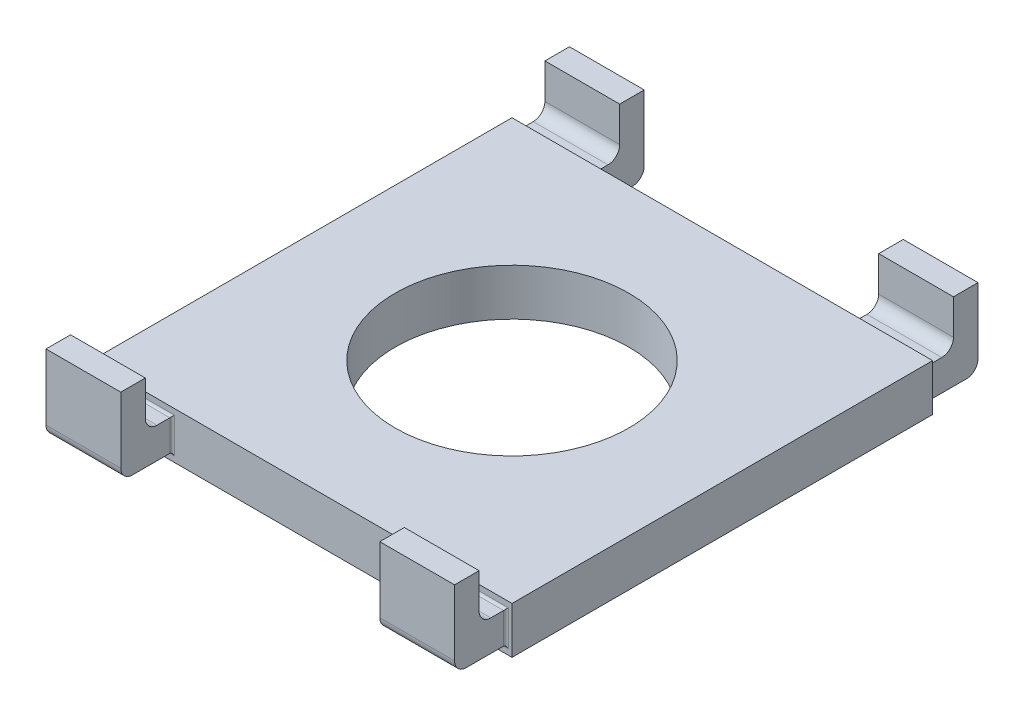
from build123d import *

# Parameters (mm, degrees)
SKETCH2_W           = 45
SKETCH2_H           = 45
BOSS_EXTRUDE1_DEPTH = 5
SKETCH3_W           = 8
SKETCH3_H           = 3.3
BOSS_EXTRUDE2_DEPTH = 28
FILLET1_R           = 0.25
SKETCH4_W           = 8
SKETCH4_H           = 2.625
BOSS_EXTRUDE3_DEPTH = 5
FILLET2_R           = 1.25
SKETCH6_R           = 12.5
CUT_EXTRUDE1_DEPTH  = 19


with BuildPart() as part:
    # Sketch2 → Boss-Extrude1 (new body)
    with BuildSketch(Plane(origin=(0, 0, 0), x_dir=(1, 0, 0), z_dir=(0, 1, 0))):
        Rectangle(SKETCH2_W, SKETCH2_H)
    extrude(amount=BOSS_EXTRUDE1_DEPTH)

    # Sketch3 → Boss-Extrude2 (add, symmetric)
    with BuildSketch(Plane.XY):
        with Locations((-17.853613933, 2.5)):
            Rectangle(SKETCH3_W, SKETCH3_H)
        with Locations((17.853613933, 2.5)):
            Rectangle(SKETCH3_W, SKETCH3_H)
    extrude(amount=BOSS_EXTRUDE2_DEPTH, both=True)

    # Fillet1
    fillet1_edges = [part.edges().sort_by_distance(p)[0] for p in [
        (-13.853613933, 2.5, -22.5),
        (-17.853613933, 4.15, -22.5),
        (-21.853613933, 2.5, -22.5),
        (-17.853613933, 0.85, -22.5),
        (17.853613933, 0.85, -22.5),
        (13.853613933, 2.5, -22.5),
        (21.853613933, 2.5, -22.5),
        (17.853613933, 4.15, -22.5),
        (21.853613933, 2.5, 22.5),
        (17.853613933, 4.15, 22.5),
        (17.853613933, 0.85, 22.5),
        (13.853613933, 2.5, 22.5),
        (-21.853613933, 2.5, 22.5),
        (-13.853613933, 2.5, 22.5),
        (-17.853613933, 0.85, 22.5),
        (-17.853613933, 4.15, 22.5),
    ]]
    fillet(fillet1_edges, radius=FILLET1_R)

    # Sketch4 → Boss-Extrude3 (add)
    with BuildSketch(Plane(origin=(0, 4.15, 0), x_dir=(1, 0, 0), z_dir=(0, 1, 0))):
        with Locations((-17.853613933, 26.6875)):
            Rectangle(SKETCH4_W, SKETCH4_H)
        with Locations((17.853613933, 26.6875)):
            Rectangle(SKETCH4_W, SKETCH4_H)
        with Locations((17.853613933, -26.6875)):
            Rectangle(SKETCH4_W, SKETCH4_H)
        with Locations((-17.853613933, -26.6875)):
            Rectangle(SKETCH4_W, SKETCH4_H)
    extrude(amount=BOSS_EXTRUDE3_DEPTH)

    # Fillet2
    fillet2_edges = [part.edges().sort_by_distance(p)[0] for p in [
        (-17.853613933, 0.85, 28),
        (17.853613933, 0.85, 28),
        (17.853613933, 0.85, -28),
        (-17.853613933, 0.85, -28),
        (17.853613933, 4.15, 25.375),
        (-17.853613933, 4.15, 25.375),
        (17.853613933, 4.15, -25.375),
        (-17.853613933, 4.15, -25.375),
    ]]
    fillet(fillet2_edges, radius=FILLET2_R)

    # Sketch6 → Cut-Extrude1 (cut)
    with BuildSketch(Plane(origin=(0, 5, 0), x_dir=(1, 0, 0), z_dir=(0, 1, 0))):
        Circle(SKETCH6_R)
    extrude(amount=-CUT_EXTRUDE1_DEPTH, mode=Mode.SUBTRACT)


solid = part.part
